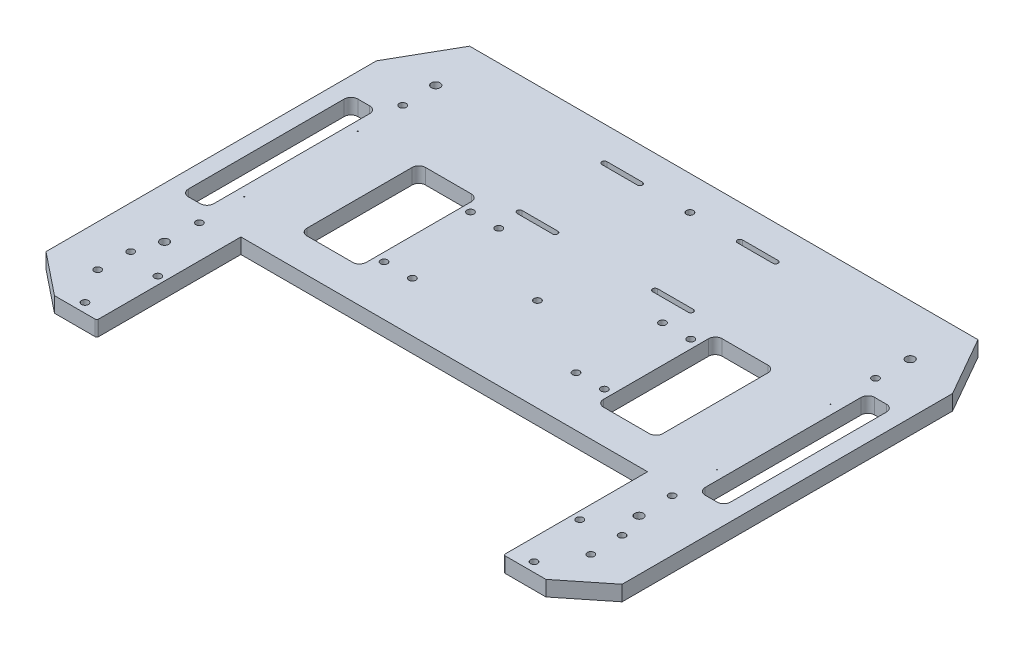
from build123d import *

# Parameters (mm, degrees)
ESQUISSE3_R          = 2.55
STRUCTURE_DEPTH      = 9
ESQUISSE4_R          = 0.25
ENCOCHES_TIGES_DEPTH = 5
ESQUISSE5_R          = 2.05
ENCODEURS_DEPTH      = 221.410979763
MOTEURS_DEPTH        = 221.410979763
MOTEURS_DEPTH_BACK   = 221.410979763
ESQUISSE6_R          = 2.05
ESQUISSE7_R          = 2.05
PATINS_DEPTH         = 221.410979763
ESQUISSE8_R          = 2.05
ACTIONNEURS_DEPTH    = 221.410979763
CONG_1_R             = 1
BATTERIE_DEPTH       = 30


with BuildPart() as part:
    # Esquisse3 → structure (new body)
    with BuildSketch(Plane(origin=(0, 0, 0), x_dir=(1, 0, 0), z_dir=(0, 1, 0))):
        Polygon((150, 110), (-150, 110), (-170, 75), (-170, 0), (-170, -120), (-145, -140), (-120, -140), (-120, -55), (120, -55), (120, -140), (145, -140), (170, -120), (170, 0), (170, 75), align=None)
        with Locations((-140, 80)):
            Circle(ESQUISSE3_R, mode=Mode.SUBTRACT)
        with Locations((-140, -80)):
            Circle(ESQUISSE3_R, mode=Mode.SUBTRACT)
        with Locations((140, -80)):
            Circle(ESQUISSE3_R, mode=Mode.SUBTRACT)
        with Locations((140, 80)):
            Circle(ESQUISSE3_R, mode=Mode.SUBTRACT)
        with BuildLine():
            Line((-160, -46), (-160, 46))
            ThreePointArc((-160, 46), (-158.828427125, 48.828427125), (-156, 50))
            Line((-156, 50), (-149, 50))
            ThreePointArc((-149, 50), (-146.171572875, 48.828427125), (-145, 46))
            Line((-145, 46), (-145, -46))
            ThreePointArc((-145, -46), (-146.171572875, -48.828427125), (-149, -50))
            Line((-149, -50), (-156, -50))
            ThreePointArc((-156, -50), (-158.828427125, -48.828427125), (-160, -46))
        make_face(mode=Mode.SUBTRACT)
        with BuildLine():
            Line((-105, 0), (-105, 31))
            ThreePointArc((-105, 31), (-103.828427125, 33.828427125), (-101, 35))
            Line((-101, 35), (-74, 35))
            ThreePointArc((-74, 35), (-71.171572875, 33.828427125), (-70, 31))
            Line((-70, 31), (-70, -31))
            ThreePointArc((-70, -31), (-71.171572875, -33.828427125), (-74, -35))
            Line((-74, -35), (-101, -35))
            ThreePointArc((-101, -35), (-103.828427125, -33.828427125), (-105, -31))
            Line((-105, -31), (-105, 0))
        make_face(mode=Mode.SUBTRACT)
        with BuildLine():
            Line((156, 50), (149, 50))
            ThreePointArc((149, 50), (146.171572875, 48.828427125), (145, 46))
            Line((145, 46), (145, -46))
            ThreePointArc((145, -46), (146.171572875, -48.828427125), (149, -50))
            Line((149, -50), (156, -50))
            ThreePointArc((156, -50), (158.828427125, -48.828427125), (160, -46))
            Line((160, -46), (160, 46))
            ThreePointArc((160, 46), (158.828427125, 48.828427125), (156, 50))
        make_face(mode=Mode.SUBTRACT)
        with BuildLine():
            Line((105, 0), (105, 31))
            ThreePointArc((105, 31), (103.828427125, 33.828427125), (101, 35))
            Line((101, 35), (74, 35))
            ThreePointArc((74, 35), (71.171572875, 33.828427125), (70, 31))
            Line((70, 31), (70, -31))
            ThreePointArc((70, -31), (71.171572875, -33.828427125), (74, -35))
            Line((74, -35), (101, -35))
            ThreePointArc((101, -35), (103.828427125, -33.828427125), (105, -31))
            Line((105, -31), (105, 0))
        make_face(mode=Mode.SUBTRACT)
    extrude(amount=-STRUCTURE_DEPTH)

    # Esquisse4 → encoches_tiges (cut)
    with BuildSketch(Plane(origin=(0, 0, 0), x_dir=(1, 0, 0), z_dir=(0, 1, 0))):
        with Locations((-139.5, 33.5)):
            Circle(ESQUISSE4_R)
        with Locations((-139.5, -33.5)):
            Circle(ESQUISSE4_R)
        with Locations((139.5, -33.5)):
            Circle(ESQUISSE4_R)
        with Locations((139.5, 33.5)):
            Circle(ESQUISSE4_R)
    extrude(amount=-ENCOCHES_TIGES_DEPTH, mode=Mode.SUBTRACT)

    # Esquisse5 → encodeurs (cut, through all)
    with BuildSketch(Plane(origin=(0, 0, 0), x_dir=(1, 0, 0), z_dir=(0, 1, 0))):
        with Locations((-139.5, 60)):
            Circle(ESQUISSE5_R)
        with Locations((-139.5, -60)):
            Circle(ESQUISSE5_R)
        with Locations((139.5, -60)):
            Circle(ESQUISSE5_R)
        with Locations((139.5, 60)):
            Circle(ESQUISSE5_R)
    extrude(amount=-ENCODEURS_DEPTH, mode=Mode.SUBTRACT)

    # Esquisse6 → moteurs (cut, two sides: drawn at the far end of the back side and taken through both)
    with BuildSketch(Plane(origin=(0, 0, 0), x_dir=(1, 0, 0), z_dir=(0, 1, 0)).offset(-MOTEURS_DEPTH_BACK)):
        with Locations((-65, 25.5)):
            Circle(ESQUISSE6_R)
        with Locations((-48.3, 25.5)):
            Circle(ESQUISSE6_R)
        with Locations((-48.3, -25.5)):
            Circle(ESQUISSE6_R)
        with Locations((-65, -25.5)):
            Circle(ESQUISSE6_R)
        with Locations((65, -25.5)):
            Circle(ESQUISSE6_R)
        with Locations((48.3, -25.5)):
            Circle(ESQUISSE6_R)
        with Locations((48.3, 25.5)):
            Circle(ESQUISSE6_R)
        with Locations((65, 25.5)):
            Circle(ESQUISSE6_R)
    extrude(amount=MOTEURS_DEPTH + MOTEURS_DEPTH_BACK, mode=Mode.SUBTRACT)

    # Esquisse7 → patins (cut, through all)
    with BuildSketch(Plane(origin=(0, 0, 0), x_dir=(1, 0, 0), z_dir=(0, 1, 0))):
        with Locations((0, 90)):
            Circle(ESQUISSE7_R)
        Circle(ESQUISSE7_R)
        with Locations((-145, -95)):
            Circle(ESQUISSE7_R)
        with Locations((145, -95)):
            Circle(ESQUISSE7_R)
    extrude(amount=-PATINS_DEPTH, mode=Mode.SUBTRACT)

    # Esquisse8 → actionneurs (cut, through all)
    with BuildSketch(Plane(origin=(0, 0, 0), x_dir=(1, 0, 0), z_dir=(0, 1, 0))):
        with Locations((-132.5, -134.5)):
            Circle(ESQUISSE8_R)
        with Locations((-124.5, -99.5)):
            Circle(ESQUISSE8_R)
        with Locations((132.5, -134.5)):
            Circle(ESQUISSE8_R)
        with Locations((124.5, -99.5)):
            Circle(ESQUISSE8_R)
        with Locations((-145.5, -114)):
            Circle(ESQUISSE8_R)
        with Locations((145.5, -114)):
            Circle(ESQUISSE8_R)
    extrude(amount=-ACTIONNEURS_DEPTH, mode=Mode.SUBTRACT)

    # Congé1
    cong_1_edges = [part.edges().sort_by_distance(p)[0] for p in [
        (120, -4.5, 140),
        (-120, -4.5, 140),
    ]]
    fillet(cong_1_edges, radius=CONG_1_R)

    # Esquisse9 → batterie (cut)
    with BuildSketch(Plane(origin=(0, 0, 0), x_dir=(1, 0, 0), z_dir=(0, 1, 0))):
        with BuildLine():
            Line((-29.5, 91.5), (-50.5, 91.5))
            ThreePointArc((-50.5, 91.5), (-52, 90), (-50.5, 88.5))
            Line((-50.5, 88.5), (-29.5, 88.5))
            ThreePointArc((-29.5, 88.5), (-28, 90), (-29.5, 91.5))
        make_face()
        with BuildLine():
            ThreePointArc((-50.5, 41.5), (-52, 40), (-50.5, 38.5))
            Line((-50.5, 38.5), (-29.5, 38.5))
            ThreePointArc((-29.5, 38.5), (-28, 40), (-29.5, 41.5))
            Line((-29.5, 41.5), (-50.5, 41.5))
        make_face()
        with BuildLine():
            Line((29.5, 38.5), (50.5, 38.5))
            ThreePointArc((50.5, 38.5), (52, 40), (50.5, 41.5))
            Line((50.5, 41.5), (29.5, 41.5))
            ThreePointArc((29.5, 41.5), (28, 40), (29.5, 38.5))
        make_face()
        with BuildLine():
            ThreePointArc((50.5, 88.5), (52, 90), (50.5, 91.5))
            Line((50.5, 91.5), (29.5, 91.5))
            ThreePointArc((29.5, 91.5), (28, 90), (29.5, 88.5))
            Line((29.5, 88.5), (50.5, 88.5))
        make_face()
    extrude(amount=-BATTERIE_DEPTH, mode=Mode.SUBTRACT)


solid = part.part
